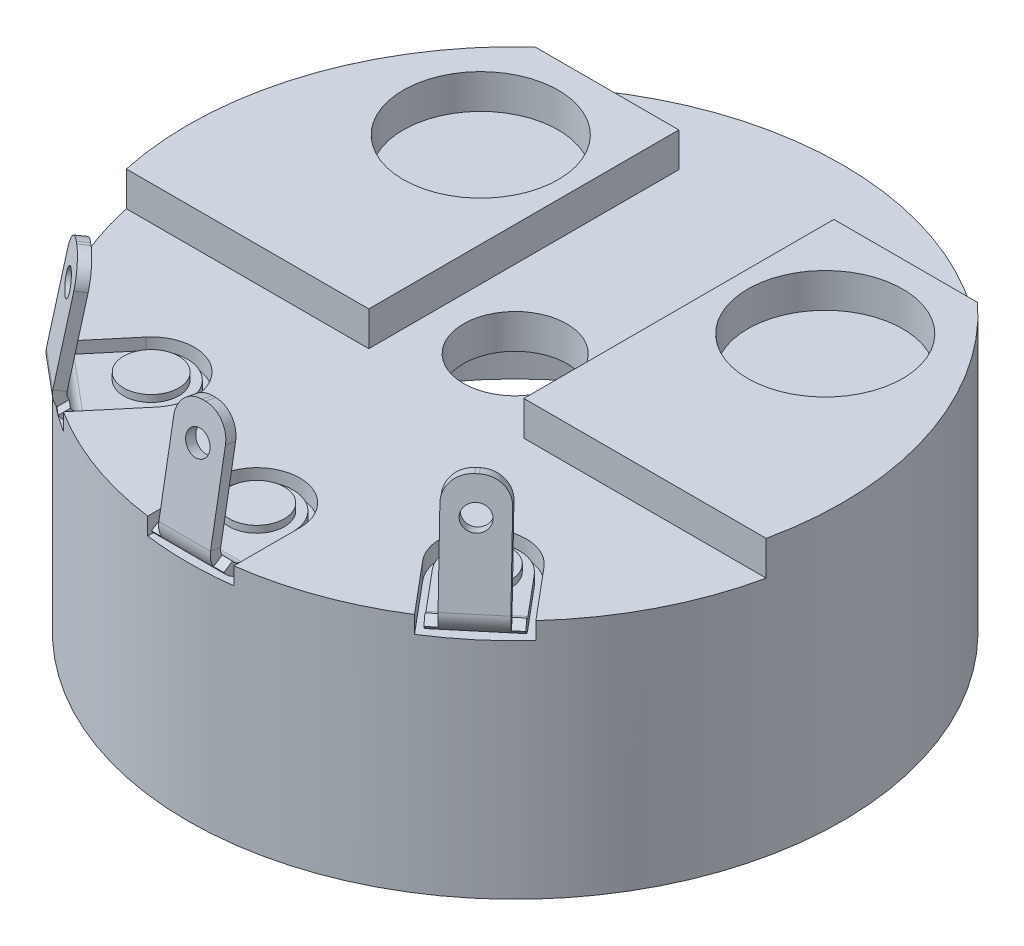
from build123d import *
from build123d.topology import SkipClean

# Parameters (mm, degrees)
SKETCH1_R                  = 4.75
SKETCH1_R_2                = 0.75
BOSS_EXTRUDE1_DEPTH        = 0.5
BOSS_EXTRUDE2_START        = 0.5
SKETCH1_3_R                = 1.125
BOSS_EXTRUDE2_DEPTH        = 0.5
SKETCH2_R                  = 0.375
CUT_EXTRUDE1_DEPTH         = 7.736096793
CUT_EXTRUDE2_DEPTH         = 0.25
CIRPATTERN1_COUNT          = 3
CIRPATTERN1_ANGLE          = 80
EXTRUDE_THIN1_START        = -0.5
SKETCH1_4_R                = 4.75
SKETCH1_4_R_2              = 4.5
EXTRUDE_THIN1_DEPTH        = 3
BASE_FLANGE1_START         = 0.15
SKETCH4_R                  = 0.175
SKETCH4_R_2                = 0.375
BASE_FLANGE1_DEPTH         = 0.15
SKETCHED_START             = -0.525
SKETCHED_BEND2_DEPTH       = 1.05
SKETCHED_BEND2_2_DEPTH     = 1.05
SKETCHED_START_2           = -0.375
SKETCHED_BEND2_3_DEPTH     = 0.75
SKETCHED_START_3           = -4.741475404
SKETCHED_BEND2_4_OUTLINE_R = 0.175
SKETCHED_BEND2_4_DEPTH     = 0.149999999
SKETCH13_R                 = 0.375
BASE_FLANGE2_DEPTH         = 0.15
CIRPATTERN2_COUNT          = 3
CIRPATTERN2_ANGLE          = 80


with BuildPart() as part:
    # Sketch1 → Boss-Extrude1 (new body)
    with BuildSketch(Plane(origin=(0, 0, 0), x_dir=(1, 0, 0), z_dir=(0, 1, 0))):
        with Locations(Location((0, 0, 0), (0, 0, 270))):
            Circle(SKETCH1_R)
        with Locations(Location((0, 0, 0), (0, 0, 270))):
            Circle(SKETCH1_R_2, mode=Mode.SUBTRACT)
    extrude(amount=-BOSS_EXTRUDE1_DEPTH)

    # Sketch1<3> → Boss-Extrude2 (add)
    # profile 1 of 2: a face of its own
    with BuildSketch(Plane(origin=(0, 0, 0), x_dir=(1, 0, 0), z_dir=(0, 1, 0)).offset(BOSS_EXTRUDE2_START)):
        with BuildLine():
            Line((1.125, -1), (4.643543905, -1))
            ThreePointArc((4.643543905, -1), (4.723310997, -0.502825243), (4.75, 0))
            ThreePointArc((4.75, 0), (4.348345299, 1.911646713), (3.211308145, 3.5))
            Line((3.211308145, 3.5), (1.125, 3.5))
            Line((1.125, 3.5), (1.125, -1))
        make_face()
        with Locations(Location((2.5, 2, 0), (0, 0, 270))):
            Circle(SKETCH1_3_R, mode=Mode.SUBTRACT)
    # profile 2 of 2: a face of its own
    with BuildSketch(Plane(origin=(0, 0, 0), x_dir=(1, 0, 0), z_dir=(0, 1, 0)).offset(BOSS_EXTRUDE2_START)):
        with BuildLine():
            ThreePointArc((-3.211308145, 3.5), (-4.526276083, 1.440598771), (-4.643543905, -1))
            Line((-4.643543905, -1), (-1.125, -1))
            Line((-1.125, -1), (-1.125, 3.5))
            Line((-1.125, 3.5), (-3.211308145, 3.5))
        make_face()
        with Locations(Location((-2.5, 2, 0), (0, 0, 270))):
            Circle(SKETCH1_3_R, mode=Mode.SUBTRACT)
    extrude(amount=-BOSS_EXTRUDE2_DEPTH)

    # Sketch2 → Cut-Extrude1 (cut, through all)
    with BuildSketch(Plane(origin=(0, 0, 0), x_dir=(1, 0, 0), z_dir=(0, 1, 0))):
        with Locations(Location((-2.410453536, -2.872666662, 0), (0, 0, 270))):
            Circle(SKETCH2_R)
    cut_extrude1 = extrude(amount=-CUT_EXTRUDE1_DEPTH, mode=Mode.SUBTRACT)

    # Sketch2<3> → Cut-Extrude2 (cut)
    with BuildSketch(Plane(origin=(0, 0, 0), x_dir=(1, 0, 0), z_dir=(0, 1, 0))):
        with BuildLine():
            Line((-3.505473113, -3.205332784), (-2.889231313, -2.470924406))
            ThreePointArc((-2.889231313, -2.470924406), (-2.00871128, -2.393888885), (-1.931675759, -3.274408918))
            Line((-1.931675759, -3.274408918), (-2.547917559, -4.008817296))
            ThreePointArc((-2.547917559, -4.008817296), (-3.053241146, -3.638711105), (-3.505473113, -3.205332784))
        make_face()
    cut_extrude2 = extrude(amount=-CUT_EXTRUDE2_DEPTH, mode=Mode.SUBTRACT)

    # CirPattern1: Cut-Extrude1, Cut-Extrude2 ×3 about axis
    cirpattern1_axis = Axis((0, 0, 0), (0, 1, 0))
    add([cut_extrude1.rotate(cirpattern1_axis, i * CIRPATTERN1_ANGLE / (CIRPATTERN1_COUNT - 1)) for i in range(1, CIRPATTERN1_COUNT)], mode=Mode.SUBTRACT)
    add([cut_extrude2.rotate(cirpattern1_axis, i * CIRPATTERN1_ANGLE / (CIRPATTERN1_COUNT - 1)) for i in range(1, CIRPATTERN1_COUNT)], mode=Mode.SUBTRACT)

    # Sketch1<4> → Extrude-Thin1 (add)
    with BuildSketch(Plane(origin=(0, 0, 0), x_dir=(1, 0, 0), z_dir=(0, 1, 0)).offset(EXTRUDE_THIN1_START)):
        Circle(SKETCH1_4_R)
        Circle(SKETCH1_4_R_2, mode=Mode.SUBTRACT)
    extrude(amount=-EXTRUDE_THIN1_DEPTH)


with BuildPart() as body_2:
    # Base-Flange1: sheet metal written as solids
    # Sketch4 → Base-Flange1 (new body)
    with BuildSketch(Plane(origin=(0, -0.25, 0), x_dir=(1, 0, 0), z_dir=(0, 1, 0)).offset(BASE_FLANGE1_START)):
        with BuildLine():
            Line((-3.428868668, -3.269611545), (-2.812626869, -2.535203167))
            ThreePointArc((-2.812626869, -2.535203167), (-2.072990041, -2.470493329), (-2.008280204, -3.210130157))
            Line((-2.008280204, -3.210130157), (-2.624522003, -3.944538535))
            Line((-2.624522003, -3.944538535), (-2.73942867, -3.848120394))
            Line((-2.73942867, -3.848120394), (-3.639331323, -4.920582614))
            ThreePointArc((-3.639331323, -4.920582614), (-3.876942368, -5.044275095), (-4.132422542, -4.963722506))
            Line((-4.132422542, -4.963722506), (-4.170724764, -4.931583125))
            ThreePointArc((-4.170724764, -4.931583125), (-4.294417245, -4.69397208), (-4.213864655, -4.438491907))
            Line((-4.213864655, -4.438491907), (-3.313962002, -3.366029686))
            Line((-3.313962002, -3.366029686), (-3.428868668, -3.269611545))
        make_face()
        with Locations(Location((-3.830179848, -4.564630594, 0), (0, 0, 270))):
            Circle(SKETCH4_R, mode=Mode.SUBTRACT)
        with Locations(Location((-2.410453536, -2.872666662, 0), (0, 0, 270))):
            Circle(SKETCH4_R_2, mode=Mode.SUBTRACT)
    extrude(amount=-BASE_FLANGE1_DEPTH)

    # Sketched Bend2: read off the stored shape, not the designer's step
    # Sketched Bend2 outline → Sketched Bend2 (cut)
    with BuildSketch(Plane(origin=(0, 0, 0), x_dir=(0.642787609686539, 0, -0.7660444431189782), z_dir=(0.7660444431189782, 0, 0.6427876096865391)).offset(SKETCHED_START)):
        with BuildLine():
            Line((-4.760983594, -0.1), (-6.45870205, -0.1))
            Line((-6.45870205, -0.1), (-6.45870205, -0.25))
            Line((-6.45870205, -0.25), (-4.501175973, -0.25))
            ThreePointArc((-4.501175973, -0.25), (-4.651175973, -0.209807621), (-4.760983594, -0.1))
        make_face()
    extrude(amount=SKETCHED_BEND2_DEPTH, mode=Mode.SUBTRACT)

    # Sketched Bend2 2 outline → Sketched Bend2 2 (add)
    with SkipClean():  # the faces are left unmerged after this step: merging them gives an invalid solid
        with BuildSketch(Plane(origin=(0, 0, 0), x_dir=(0.642787609686539, 0, -0.7660444431189782), z_dir=(0.7660444431189782, 0, 0.6427876096865391)).offset(SKETCHED_START)):
            with BuildLine():
                ThreePointArc((-4.501175973, -0.1), (-4.57325702, -0.081545895), (-4.627602184, -0.030724302))
                Line((-4.627602184, -0.030724302), (-4.754028396, -0.111448605))
                ThreePointArc((-4.754028396, -0.111448605), (-4.73301345, -0.140397963), (-4.70870205, -0.166640087))
                Line((-4.70870205, -0.166640087), (-4.70870205, -0.1))
                Line((-4.70870205, -0.1), (-4.501175973, -0.1))
            make_face()
        extrude(amount=SKETCHED_BEND2_2_DEPTH)

    # Sketched Bend2 3 outline → Sketched Bend2 3 (add)
    with SkipClean():  # the faces are left unmerged after this step: merging them gives an invalid solid
        with BuildSketch(Plane(origin=(0, 0, 0), x_dir=(0.642787609686539, 0, -0.7660444431189782), z_dir=(0.7660444431189782, 0, 0.6427876096865391)).offset(SKETCHED_START_2)):
            with BuildLine():
                ThreePointArc((-4.627602184, -0.030724302), (-4.648278779, 0.020661214), (-4.648897136, 0.076047227))
                Line((-4.648897136, 0.076047227), (-4.371712461, 1.648039633))
                Line((-4.371712461, 1.648039633), (-4.519433624, 1.674086859))
                Line((-4.519433624, 1.674086859), (-4.796618299, 0.102094453))
                ThreePointArc((-4.796618299, 0.102094453), (-4.796618299, -0.002094454), (-4.760983594, -0.1))
                Line((-4.760983594, -0.1), (-4.736098185, -0.1))
                Line((-4.736098185, -0.1), (-4.627602184, -0.030724302))
            make_face()
        extrude(amount=SKETCHED_BEND2_3_DEPTH)

    # Sketched Bend2 4 outline → Sketched Bend2 4 (cut)
    with SkipClean():  # the faces are left unmerged after this step: merging them gives an invalid solid
        with BuildSketch(Plane(origin=(0, 0, 0), x_dir=(0.774133623486211, 0.14199506630580708, 0.6168910228986306), z_dir=(0.633022221559488, -0.173648177666934, -0.754406506735489)).offset(SKETCHED_START_3)):
            with BuildLine():
                Line((-0.246525022, -0.908905109), (0.099817711, -0.858440159))
                ThreePointArc((0.099817711, -0.858440159), (-0.159864425, -0.792682829), (-0.296989971, -0.562562375))
                Line((-0.296989971, -0.562562375), (-0.246525022, -0.908905109))
            make_face()
            with BuildLine():
                ThreePointArc((0.445173029, -0.454423198), (0.379415699, -0.714105335), (0.149295245, -0.851230881))
                Line((0.149295245, -0.851230881), (0.495637978, -0.800765932))
                Line((0.495637978, -0.800765932), (0.445173029, -0.454423198))
            make_face()
            with Locations((0.052463694, -0.360060187)):
                Circle(SKETCHED_BEND2_4_OUTLINE_R)
        extrude(amount=SKETCHED_BEND2_4_DEPTH, mode=Mode.SUBTRACT)


with BuildPart() as body_3:
    # Base-Flange2: sheet metal written as solids
    # Sketch13 → Base-Flange2 (new body)
    with BuildSketch(Plane.XZ.offset(0.5)):
        with BuildLine():
            ThreePointArc((-2.828265483, 3.37059555), (0, -4.4), (2.828265483, 3.37059555))
            ThreePointArc((2.828265483, 3.37059555), (1.912524648, 3.290478608), (1.99264159, 2.374737774))
            ThreePointArc((1.99264159, 2.374737774), (0, -3.1), (-1.99264159, 2.374737774))
            ThreePointArc((-1.99264159, 2.374737774), (-1.912524648, 3.290478608), (-2.828265483, 3.37059555))
        make_face()
        with Locations(Location((-2.410453536, 2.872666662, 0), (0, 0, 270))):
            Circle(SKETCH13_R, mode=Mode.SUBTRACT)
        with Locations(Location((2.410453536, 2.872666662, 0), (0, 0, 270))):
            Circle(SKETCH13_R, mode=Mode.SUBTRACT)
    extrude(amount=BASE_FLANGE2_DEPTH)


with BuildPart() as body_4:
    # Sketch16 → Revolve1 (revolve)
    with BuildSketch(Plane(origin=(0, 0, 0), x_dir=(-0.6427876096865403, 0, 0.7660444431189773), z_dir=(-0.7660444431189773, 0, -0.6427876096865403)), mode=Mode.PRIVATE) as revolve1_sk:
        Polygon((3.375, -0.1), (3.35, -0.1), (3.35, 0), (3.75, 0), (3.75, -0.75), (3.35, -0.75), (3.35, -0.65), (3.375, -0.65), align=None)
    revolve(revolve1_sk.sketch.rotate(Axis((-2.410453536, 0, 2.872666662), (0, -1, 0)), 140), axis=Axis((-2.410453536, 0, 2.872666662), (0, -1, 0)))


with BuildPart() as cirpattern2_1:
    # CirPattern2: pattern copy
    add(body_4.part.rotate(Axis((0, 0, 0), (0, 1, 0)), 1 * CIRPATTERN2_ANGLE / (CIRPATTERN2_COUNT - 1)))


with BuildPart() as cirpattern2_2:
    # CirPattern2: pattern copy
    add(body_4.part.rotate(Axis((0, 0, 0), (0, 1, 0)), 2 * CIRPATTERN2_ANGLE / (CIRPATTERN2_COUNT - 1)))


with BuildPart() as cirpattern2_3:
    # CirPattern2: pattern copy
    add(body_2.part.rotate(Axis((0, 0, 0), (0, 1, 0)), 1 * CIRPATTERN2_ANGLE / (CIRPATTERN2_COUNT - 1)))


with BuildPart() as cirpattern2_4:
    # CirPattern2: pattern copy
    add(body_2.part.rotate(Axis((0, 0, 0), (0, 1, 0)), 2 * CIRPATTERN2_ANGLE / (CIRPATTERN2_COUNT - 1)))


solid = Compound([part.part, body_2.part, body_3.part, body_4.part, cirpattern2_1.part, cirpattern2_2.part, cirpattern2_3.part, cirpattern2_4.part])
